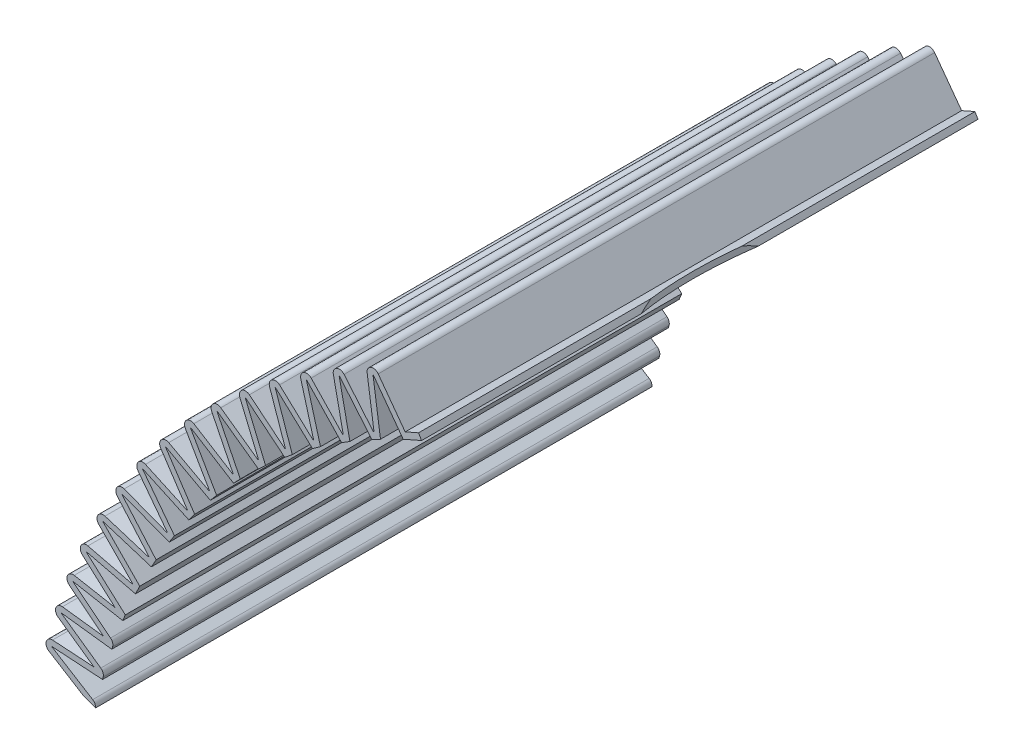
from build123d import *

# Parameters (mm, degrees)
EXTRUDE_THIN1_DEPTH = 140
SKETCH4_R           = 56.18975848
CUT_EXTRUDE1_DEPTH  = 178
SKETCH5_OUTSIDE_W   = 380.976
SKETCH5_OUTSIDE_H   = 186.224
SKETCH5_OUTSIDE_R   = 68.729840683
CUT_EXTRUDE2_DEPTH  = 252.156201302


# Read off the part's stored shape, not the designer's step: Extrude-Thin1
with BuildPart() as part:
    # Extrude-Thin1 outline → Extrude-Thin1 (new body)
    with BuildSketch(Plane.XY):
        with BuildLine():
            Line((-139.306260049, 30.123191015), (-153.449190625, 34.012444173))
            Line((-153.449190625, 34.012444173), (-153.846920334, 32.566134705))
            Line((-153.846920334, 32.566134705), (-136.543453897, 27.807745972))
            Line((-136.543453897, 27.807745972), (-136.294778027, 28.712034125))
            ThreePointArc((-136.294778027, 28.712034125), (-136.346175998, 29.688618017), (-136.97203427, 30.440056154))
            Line((-136.97203427, 30.440056154), (-147.201259055, 36.787628251))
            ThreePointArc((-147.201259055, 36.787628251), (-147.222511999, 36.845367401), (-147.17166442, 36.880008718))
            Line((-147.17166442, 36.880008718), (-134.502757554, 36.05955404))
            Line((-134.502757554, 36.05955404), (-134.339273093, 36.654051051))
            ThreePointArc((-134.339273093, 36.654051051), (-134.37483136, 37.588422876), (-134.941333261, 38.332325217))
            Line((-134.941333261, 38.332325217), (-144.813207472, 45.28438143))
            ThreePointArc((-144.813207472, 45.28438143), (-144.831067227, 45.343258644), (-144.778291459, 45.374884829))
            Line((-144.778291459, 45.374884829), (-132.178523576, 43.819186808))
            Line((-132.178523576, 43.819186808), (-131.980748778, 44.403172248))
            ThreePointArc((-131.980748778, 44.403172248), (-131.961917996, 45.338030793), (-132.484207391, 46.113613725))
            Line((-132.484207391, 46.113613725), (-141.935153834, 53.627906596))
            ThreePointArc((-141.935153834, 53.627906596), (-141.949559967, 53.687722652), (-141.895034589, 53.716226692))
            Line((-141.895034589, 53.716226692), (-129.40444339, 51.430074186))
            ThreePointArc((-129.40444339, 51.430074186), (-129.087143162, 52.221374648), (-128.765004232, 53.010717644))
            Line((-128.765004232, 53.010717644), (-138.576836564, 61.789971902))
            ThreePointArc((-138.576836564, 61.789971902), (-138.58774033, 61.8505244), (-138.531649838, 61.875809848))
            Line((-138.531649838, 61.875809848), (-126.195118689, 58.867261862))
            ThreePointArc((-126.195118689, 58.867261862), (-125.674194404, 59.971321153), (-125.143611122, 61.070771202))
            Line((-125.143611122, 61.070771202), (-134.378874345, 70.454654846))
            ThreePointArc((-134.378874345, 70.454654846), (-134.385915682, 70.515776993), (-134.328334415, 70.537454053))
            Line((-134.328334415, 70.537454053), (-122.207454601, 66.752532087))
            ThreePointArc((-122.207454601, 66.752532087), (-121.617555337, 67.82132949), (-121.01830886, 68.884914319))
            Line((-121.01830886, 68.884914319), (-129.639815827, 78.835641762))
            ThreePointArc((-129.639815827, 78.835641762), (-129.642966381, 78.897087439), (-129.584126201, 78.915068827))
            Line((-129.584126201, 78.915068827), (-117.727704225, 74.369013426))
            ThreePointArc((-117.727704225, 74.369013426), (-117.071205299, 75.39824527), (-116.40570858, 76.421682199))
            Line((-116.40570858, 76.421682199), (-124.378743527, 86.899185373))
            ThreePointArc((-124.378743527, 86.899185373), (-124.377990612, 86.96070716), (-124.318128446, 86.974920471))
            Line((-124.318128446, 86.974920471), (-112.773905936, 81.686036996))
            ThreePointArc((-112.773905936, 81.686036996), (-112.053450837, 82.671558928), (-111.324383596, 83.650726936))
            Line((-111.324383596, 83.650726936), (-118.616841925, 94.612816635))
            ThreePointArc((-118.616841925, 94.612816635), (-118.612188573, 94.674166806), (-118.551545464, 94.684554808))
            Line((-118.551545464, 94.684554808), (-107.36600693, 88.674139725))
            ThreePointArc((-107.36600693, 88.674139725), (-106.584496676, 89.611983397), (-105.794794611, 90.542939721))
            Line((-105.794794611, 90.542939721), (-112.377312165, 101.945475477))
            ThreePointArc((-112.377312165, 101.945475477), (-112.368777114, 102.006406997), (-112.307597252, 102.01292786))
            Line((-112.307597252, 102.01292786), (-101.525782909, 95.30518299))
            ThreePointArc((-101.525782909, 95.30518299), (-100.686364366, 96.191572036), (-99.839207327, 97.070568043))
            Line((-99.839207327, 97.070568043), (-105.685278633, 108.867635871))
            ThreePointArc((-105.685278633, 108.867635871), (-105.672896249, 108.927903389), (-105.611425983, 108.930530858))
            Line((-105.611425983, 108.930530858), (-95.276750392, 101.552465921))
            ThreePointArc((-95.276750392, 101.552465921), (-94.382803603, 102.383831165), (-93.481602794, 103.207327449))
            Line((-93.481602794, 103.207327449), (-98.567687784, 115.351424719))
            ThreePointArc((-98.567687784, 115.351424719), (-98.551507928, 115.41078556), (-98.489994777, 115.409509053))
            Line((-98.489994777, 115.409509053), (-88.64407203, 107.390832914))
            ThreePointArc((-88.64407203, 107.390832914), (-87.699196602, 108.163826741), (-86.747580839, 108.928507373))
            Line((-86.747580839, 108.928507373), (-91.053199645, 121.370734092))
            ThreePointArc((-91.053199645, 121.370734092), (-91.033287468, 121.428949231), (-90.971979124, 121.423773889))
            Line((-90.971979124, 121.423773889), (-81.654455275, 112.796774926))
            ThreePointArc((-81.654455275, 112.796774926), (-80.662455889, 113.508284763), (-79.664256994, 114.211070644))
            Line((-79.664256994, 114.211070644), (-83.172072408, 126.901326356))
            ThreePointArc((-83.172072408, 126.901326356), (-83.148508088, 126.958161381), (-83.087651418, 126.949108043))
            Line((-83.087651418, 126.949108043), (-74.336044849, 117.748524136))
            ThreePointArc((-74.336044849, 117.748524136), (-73.300915936, 118.395684984), (-72.260153302, 119.033746243))
            Line((-72.260153302, 119.033746243), (-74.956040591, 131.920931768))
            ThreePointArc((-74.956040591, 131.920931768), (-74.928919014, 131.976157824), (-74.868759066, 131.963262945))
            Line((-74.868759066, 131.963262945), (-66.718309406, 122.226141598))
            ThreePointArc((-66.718309406, 122.226141598), (-65.644219065, 122.806347569), (-64.565083478, 123.377114959))
            Line((-64.565083478, 123.377114959), (-66.438187253, 136.409338149))
            ThreePointArc((-66.438187253, 136.409338149), (-66.407617627, 136.46273286), (-66.348396645, 136.446048363))
            Line((-66.348396645, 136.446048363), (-58.831922879, 126.211597527))
            ThreePointArc((-58.831922879, 126.211597527), (-28.839094717, 136.230940377), (2.640944239, 139.224954349))
            Line((2.640944239, 139.224954349), (2.669392471, 140.724684558))
            ThreePointArc((2.669392471, 140.724684558), (-28.547338144, 137.824569598), (-58.347701398, 128.086331205))
            Line((-58.347701398, 128.086331205), (-65.139420938, 137.333954742))
            ThreePointArc((-65.139420938, 137.333954742), (-66.975271388, 137.851174147), (-67.922929799, 136.195938115))
            Line((-67.922929799, 136.195938115), (-66.200191559, 124.209891464))
            ThreePointArc((-66.200191559, 124.209891464), (-66.277091374, 124.168875564), (-66.353965778, 124.127812055))
            Line((-66.353965778, 124.127812055), (-73.71853192, 132.92605966))
            ThreePointArc((-73.71853192, 132.92605966), (-75.583490291, 133.325800903), (-76.424259203, 131.613793186))
            Line((-76.424259203, 131.613793186), (-73.944787332, 119.761141137))
            ThreePointArc((-73.944787332, 119.761141137), (-74.018930934, 119.715330527), (-74.093046156, 119.669474016))
            Line((-74.093046156, 119.669474016), (-82.000804394, 127.982918251))
            ThreePointArc((-82.000804394, 127.982918251), (-83.887361157, 128.263571716), (-84.617855088, 126.501685964))
            Line((-84.617855088, 126.501685964), (-81.391633546, 114.830154963))
            ThreePointArc((-81.391633546, 114.830154963), (-81.462722385, 114.779734107), (-81.533779988, 114.729269242))
            Line((-81.533779988, 114.729269242), (-89.95288857, 122.524434801))
            ThreePointArc((-89.95288857, 122.524434801), (-91.853447226, 122.684870395), (-92.470724737, 120.880201101))
            Line((-92.470724737, 120.880201101), (-88.510744377, 109.436788283))
            ThreePointArc((-88.510744377, 109.436788283), (-88.578492203, 109.381960208), (-88.646206066, 109.327090194))
            Line((-88.646206066, 109.327090194), (-97.542764211, 116.572588696))
            ThreePointArc((-97.542764211, 116.572588696), (-99.449671882, 116.612160402), (-99.951247413, 114.771974332))
            Line((-99.951247413, 114.771974332), (-95.273453681, 103.602758282))
            ThreePointArc((-95.273453681, 103.602758282), (-95.337587697, 103.543743762), (-95.401685158, 103.484689539))
            Line((-95.401685158, 103.484689539), (-104.739869569, 110.15134592))
            ThreePointArc((-104.739869569, 110.15134592), (-106.64544781, 110.069894396), (-107.029301694, 108.20160133))
            Line((-107.029301694, 108.20160133), (-101.652530412, 97.35155654))
            ThreePointArc((-101.652530412, 97.35155654), (-101.712792374, 97.288593204), (-101.773015336, 97.225592564))
            Line((-101.773015336, 97.225592564), (-111.515224439, 103.286562551))
            ThreePointArc((-111.515224439, 103.286562551), (-113.41180016, 103.084415775), (-113.676386752, 101.195538669))
            Line((-113.676386752, 101.195538669), (-107.622288282, 90.708354439))
            ThreePointArc((-107.622288282, 90.708354439), (-107.678435535, 90.641695818), (-107.734541501, 90.575002444))
            Line((-107.734541501, 90.575002444), (-117.841546858, 96.005880649))
            ThreePointArc((-117.841546858, 96.005880649), (-119.721483218, 95.683852593), (-119.865737122, 93.781997289))
            Line((-119.865737122, 93.781997289), (-113.158689181, 83.69990181))
            ThreePointArc((-113.158689181, 83.69990181), (-113.21049564, 83.629816316), (-113.262258691, 83.559698756))
            Line((-113.262258691, 83.559698756), (-123.69336296, 88.338616951))
            ThreePointArc((-123.69336296, 88.338616951), (-125.549090119, 87.898004309), (-125.572430475, 85.990828907))
            Line((-125.572430475, 85.990828907), (-118.239439977, 76.354419217))
            ThreePointArc((-118.239439977, 76.354419217), (-118.286697036, 76.281189059), (-118.333908741, 76.207929653))
            Line((-118.333908741, 76.207929653), (-129.047109547, 80.31564482))
            ThreePointArc((-129.047109547, 80.31564482), (-130.871155145, 79.758221784), (-130.77348797, 77.853405806))
            Line((-130.77348797, 77.853405806), (-122.84408228, 68.701484327))
            ThreePointArc((-122.84408228, 68.701484327), (-122.886599652, 68.625404377), (-122.929069906, 68.549298114))
            Line((-122.929069906, 68.549298114), (-133.881228969, 71.969269935))
            ThreePointArc((-133.881228969, 71.969269935), (-135.666248219, 71.29728105), (-135.447966785, 69.402494519))
            Line((-135.447966785, 69.402494519), (-126.954074821, 60.771912807))
            ThreePointArc((-126.954074821, 60.771912807), (-126.991681304, 60.693289413), (-127.029239094, 60.614642746))
            Line((-127.029239094, 60.614642746), (-138.176255935, 63.333100201))
            ThreePointArc((-138.176255935, 63.333100201), (-139.915061195, 62.549251329), (-139.577044443, 60.67212388))
            Line((-139.577044443, 60.67212388), (-131.350294814, 53.311141318))
            Line((-131.350294814, 53.311141318), (-141.624975855, 55.191715858))
            ThreePointArc((-141.624975855, 55.191715858), (-143.315262573, 54.3080906), (-142.868672437, 52.45379288))
            Line((-142.868672437, 52.45379288), (-134.227838095, 45.583606885))
            Line((-134.227838095, 45.583606885), (-144.594481686, 46.86358022))
            ThreePointArc((-144.594481686, 46.86358022), (-146.230530468, 45.883168485), (-145.676878068, 44.057974849))
            Line((-145.676878068, 44.057974849), (-136.651196861, 37.701831956))
            Line((-136.651196861, 37.701831956), (-147.074725563, 38.37687306))
            ThreePointArc((-147.074725563, 38.37687306), (-148.651000536, 37.30299225), (-147.992159257, 35.513078578))
            Line((-147.992159257, 35.513078578), (-139.306260049, 30.123191015))
        make_face()
    extrude_thin1 = extrude(amount=EXTRUDE_THIN1_DEPTH)

    # Mirror2: Extrude-Thin1 across plane
    add(extrude_thin1.mirror(Plane(origin=(0, 0, 0), x_dir=(0, 0, 1), z_dir=(1, 0, 0))))

    # Sketch4 → Cut-Extrude1 (cut)
    with BuildSketch(Plane(origin=(0, 0, 0), x_dir=(1, 0, 0), z_dir=(0, 1, 0))):
        with Locations(Location((0, -70, 0), (0, 0, 90))):
            Circle(SKETCH4_R)
    extrude(amount=CUT_EXTRUDE1_DEPTH, mode=Mode.SUBTRACT)

    # Sketch5 outside → Cut-Extrude2 (cut, through all)
    with BuildSketch(Plane.XY.offset(140)):
        with Locations((0, 84.279)):
            Rectangle(SKETCH5_OUTSIDE_W, SKETCH5_OUTSIDE_H)
        with Locations((-113.77711878, 93.935838244)):
            Circle(SKETCH5_OUTSIDE_R, mode=Mode.SUBTRACT)
    extrude(amount=-CUT_EXTRUDE2_DEPTH, mode=Mode.SUBTRACT)


solid = part.part
